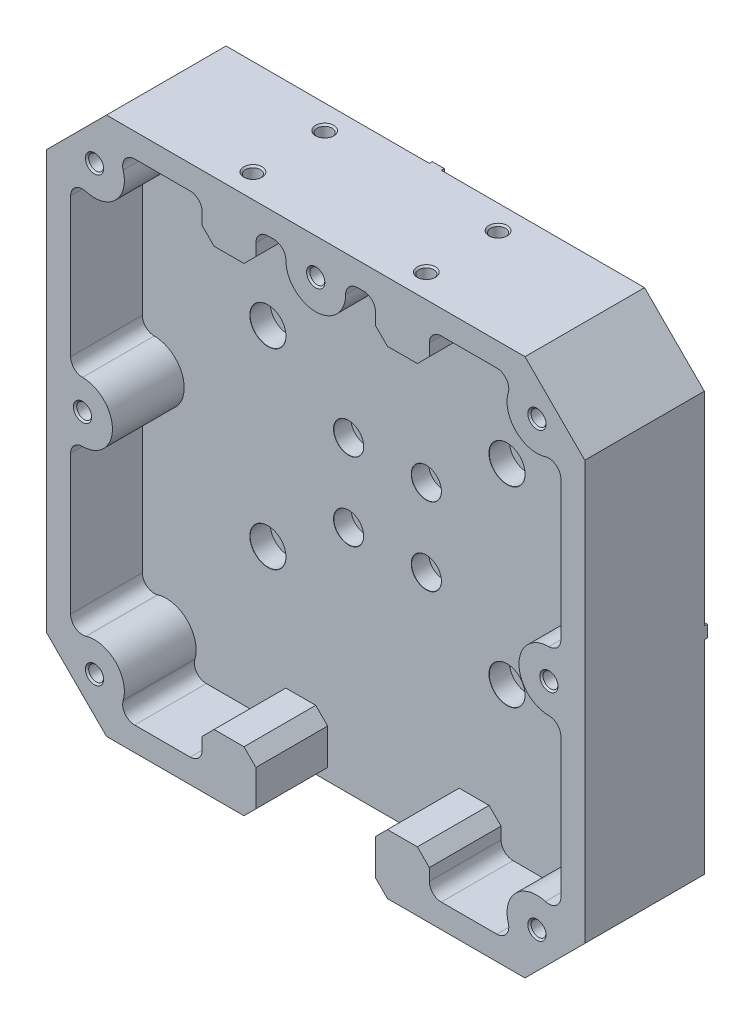
from build123d import *

# Parameters (mm, degrees)
SKETCH1_W                                    = 90
SKETCH1_H                                    = 90
BOSS_EXTRUDE1_DEPTH                          = 8
SKETCH7_W                                    = 44
SKETCH7_H                                    = 2
SKETCH7_W_2                                  = 2
SKETCH7_H_2                                  = 44
BOSS_EXTRUDE2_DEPTH                          = 0.5
FILLET1_R                                    = 0.5
CBORE_FOR_M2_5_HEXAGON_SOCKET_HEAD_C_2_COUNT = 2
CBORE_FOR_M2_5_HEXAGON_SOCKET_HEAD_C_2_PITCH = 13
CBORE_FOR_M2_5_HEXAGON_SOCKET_HEAD_C_3_COUNT = 2
CBORE_FOR_M2_5_HEXAGON_SOCKET_HEAD_C_3_PITCH = 13
CBORE_FOR_M2_5_HEXAGON_SOCKET_HEAD_C_4_COUNT = 2
CBORE_FOR_M2_5_HEXAGON_SOCKET_HEAD_C_4_PITCH = 18.384776311
CBORE_FOR_M3_HEXAGON_SOCKET_HEAD_CAP_2_COUNT = 2
CBORE_FOR_M3_HEXAGON_SOCKET_HEAD_CAP_2_PITCH = 32
CBORE_FOR_M3_HEXAGON_SOCKET_HEAD_CAP_3_COUNT = 2
CBORE_FOR_M3_HEXAGON_SOCKET_HEAD_CAP_3_PITCH = 51.224993899
CBORE_FOR_M3_HEXAGON_SOCKET_HEAD_CAP_4_COUNT = 2
CBORE_FOR_M3_HEXAGON_SOCKET_HEAD_CAP_4_PITCH = 40
CHAMFER2_SIZE                                = 10
BOSS_EXTRUDE8_DEPTH                          = 12
BOSS_EXTRUDE9_DEPTH                          = 12
SKETCH37_W                                   = 20
SKETCH37_H                                   = 8
CUT_EXTRUDE4_DEPTH                           = 12
SKETCH41_W                                   = 9
SKETCH41_H                                   = 6
BOSS_EXTRUDE10_DEPTH                         = 12
CHAMFER3_SIZE                                = 2
FILLET6_R                                    = 2
FILLET7_R                                    = 2
FILLET8_R                                    = 2
FILLET9_R                                    = 2
FILLET10_R                                   = 2
FILLET11_R                                   = 2
FILLET12_R                                   = 2
FILLET13_R                                   = 2
M3_TAPPED_HOLE2_D                            = 2.5
M3_TAPPED_HOLE2_CSINK_D                      = 3.05
M3_TAPPED_HOLE2_CSINK_ANGLE                  = 90
FILLET14_R                                   = 2
M3_TAPPED_HOLE1_AT_2_COUNT                   = 2
M3_TAPPED_HOLE1_AT_2_PITCH                   = 12
M3_TAPPED_HOLE1_AT_3_COUNT                   = 2
M3_TAPPED_HOLE1_AT_3_PITCH                   = 29
M3_TAPPED_HOLE1_AT_4_COUNT                   = 2
M3_TAPPED_HOLE1_AT_4_PITCH                   = 31.384709653


# Some blends are built 0.0001 mm under size
with BuildPart() as part:
    # Sketch1 → Boss-Extrude1 (new body)
    with BuildSketch(Plane.XY):
        Rectangle(SKETCH1_W, SKETCH1_H)
    extrude(amount=BOSS_EXTRUDE1_DEPTH)

    # Sketch7 → Boss-Extrude2 (add)
    with BuildSketch(Plane(origin=(0, 0, 0), x_dir=(-1, 0, 0), z_dir=(0, 0, -1))):
        with Locations((-23, 0)):
            Rectangle(SKETCH7_W, SKETCH7_H)
        Rectangle(SKETCH7_W_2, SKETCH7_H)
        with Locations((0, 23)):
            Rectangle(SKETCH7_W_2, SKETCH7_H_2)
        with Locations((23, 0)):
            Rectangle(SKETCH7_W, SKETCH7_H)
        with Locations((0, -23)):
            Rectangle(SKETCH7_W_2, SKETCH7_H_2)
    extrude(amount=BOSS_EXTRUDE2_DEPTH)

    # Fillet1
    fillet1_edges = [part.edges().sort_by_distance(p)[0] for p in [
        (1, -1, -0.25),
        (-1, -1, -0.25),
        (-1, 1, -0.25),
        (1, 1, -0.25),
    ]]
    fillet(fillet1_edges, radius=FILLET1_R)

    # Sketch9 → CBORE for M2.5 Hexagon socket head cap screws1 (revolve, cut)
    with BuildSketch(Plane(origin=(-6.5, 6.5, 8), x_dir=(0, -1, 0), z_dir=(1, 0, 0))):
        Polygon((0, 0), (0, 8.5), (1.35, 8.5), (1.35, 2.9), (2.5, 2.9), (2.5, 0.025), (2.525, 0), align=None)
    cbore_for_m2_5_hexagon_socket_head_cap_s = revolve(axis=Axis((-6.5, 6.5, 14.35), (0, 0, -1)), mode=Mode.SUBTRACT)

    # CBORE for M2.5 Hexagon socket head c 2: CBORE for M2.5 Hexagon socket head cap screws1 ×2
    with Locations(*[(i * CBORE_FOR_M2_5_HEXAGON_SOCKET_HEAD_C_2_PITCH, 0, 0) for i in range(1, CBORE_FOR_M2_5_HEXAGON_SOCKET_HEAD_C_2_COUNT)]):
        add(cbore_for_m2_5_hexagon_socket_head_cap_s, mode=Mode.SUBTRACT)

    # CBORE for M2.5 Hexagon socket head c 3: CBORE for M2.5 Hexagon socket head cap screws1 ×2
    with Locations(*[(0, -i * CBORE_FOR_M2_5_HEXAGON_SOCKET_HEAD_C_3_PITCH, 0) for i in range(1, CBORE_FOR_M2_5_HEXAGON_SOCKET_HEAD_C_3_COUNT)]):
        add(cbore_for_m2_5_hexagon_socket_head_cap_s, mode=Mode.SUBTRACT)

    # CBORE for M2.5 Hexagon socket head c 4: CBORE for M2.5 Hexagon socket head cap screws1 ×2
    with Locations(*[Vector(0.707106781186547, -0.7071067811865481, 0) * (i * CBORE_FOR_M2_5_HEXAGON_SOCKET_HEAD_C_4_PITCH) for i in range(1, CBORE_FOR_M2_5_HEXAGON_SOCKET_HEAD_C_4_COUNT)]):
        add(cbore_for_m2_5_hexagon_socket_head_cap_s, mode=Mode.SUBTRACT)

    # Sketch6 → CBORE for M3 Hexagon socket head cap screws1 (revolve, cut)
    with BuildSketch(Plane(origin=(20, -16, 8), x_dir=(0, -1, 0), z_dir=(1, 0, 0))):
        Polygon((0, 0), (0, 8.5), (1.6, 8.5), (1.6, 3.4), (3, 3.4), (3, 0.025), (3.025, 0), align=None)
    cbore_for_m3_hexagon_socket_head_cap_scr = revolve(axis=Axis((20, -16, 14.35), (0, 0, -1)), mode=Mode.SUBTRACT)

    # CBORE for M3 Hexagon socket head cap 2: CBORE for M3 Hexagon socket head cap screws1 ×2
    with Locations(*[(0, i * CBORE_FOR_M3_HEXAGON_SOCKET_HEAD_CAP_2_PITCH, 0) for i in range(1, CBORE_FOR_M3_HEXAGON_SOCKET_HEAD_CAP_2_COUNT)]):
        add(cbore_for_m3_hexagon_socket_head_cap_scr, mode=Mode.SUBTRACT)

    # CBORE for M3 Hexagon socket head cap 3: CBORE for M3 Hexagon socket head cap screws1 ×2
    with Locations(*[Vector(-0.7808688094430304, 0.6246950475544244, 0) * (i * CBORE_FOR_M3_HEXAGON_SOCKET_HEAD_CAP_3_PITCH) for i in range(1, CBORE_FOR_M3_HEXAGON_SOCKET_HEAD_CAP_3_COUNT)]):
        add(cbore_for_m3_hexagon_socket_head_cap_scr, mode=Mode.SUBTRACT)

    # CBORE for M3 Hexagon socket head cap 4: CBORE for M3 Hexagon socket head cap screws1 ×2
    with Locations(*[(-i * CBORE_FOR_M3_HEXAGON_SOCKET_HEAD_CAP_4_PITCH, 0, 0) for i in range(1, CBORE_FOR_M3_HEXAGON_SOCKET_HEAD_CAP_4_COUNT)]):
        add(cbore_for_m3_hexagon_socket_head_cap_scr, mode=Mode.SUBTRACT)

    # Chamfer2
    chamfer2_edges = [part.edges().sort_by_distance(p)[0] for p in [
        (45, -45, 4),
        (-45, -45, 4),
        (-45, 45, 4),
        (45, 45, 4),
    ]]
    chamfer(chamfer2_edges, length=CHAMFER2_SIZE)

    # Sketch34 → Boss-Extrude8 (add)
    with BuildSketch(Plane.XY.offset(8)):
        Polygon((35, 45), (-35, 45), (-45, 35), (-45, -35), (-35, -45), (35, -45), (45, -35), (45, 35), align=None)
        Polygon((33.343145751, 41), (-33.343145751, 41), (-41, 33.343145751), (-41, -33.343145751), (-33.343145751, -41), (33.343145751, -41), (41, -33.343145751), (41, 33.343145751), align=None, mode=Mode.SUBTRACT)
    extrude(amount=BOSS_EXTRUDE8_DEPTH)

    # Sketch36 → Boss-Extrude9 (add)
    with BuildSketch(Plane.XY.offset(8)):
        with BuildLine():
            ThreePointArc((-32, 37), (-32.42840413, 39.024971901), (-33.640204479, 40.702941271))
            Line((-33.640204479, 40.702941271), (-40.702941271, 33.640204479))
            ThreePointArc((-40.702941271, 33.640204479), (-35.199264922, 32.335522197), (-32, 37))
        make_face()
        with BuildLine():
            Line((-4.582575695, 41), (4.582575695, 41))
            ThreePointArc((4.582575695, 41), (0, 44), (-4.582575695, 41))
        make_face()
        with BuildLine():
            ThreePointArc((5, 39), (4.894531565, 40.021548218), (4.582575695, 41))
            Line((4.582575695, 41), (-4.582575695, 41))
            ThreePointArc((-4.582575695, 41), (-1.021548218, 34.105468435), (5, 39))
        make_face()
        with BuildLine():
            Line((40.702941271, 33.640204479), (33.640204479, 40.702941271))
            ThreePointArc((33.640204479, 40.702941271), (33.464466094, 33.464466094), (40.702941271, 33.640204479))
        make_face()
        with BuildLine():
            Line((41, -4.582575695), (41, 4.582575695))
            ThreePointArc((41, 4.582575695), (34, 0), (41, -4.582575695))
        make_face()
        with BuildLine():
            ThreePointArc((44, 0), (43.183300133, 2.738612788), (41, 4.582575695))
            Line((41, 4.582575695), (41, -4.582575695))
            ThreePointArc((41, -4.582575695), (43.183300133, -2.738612788), (44, 0))
        make_face()
        with BuildLine():
            Line((-41, -4.582575695), (-41, 4.582575695))
            ThreePointArc((-41, 4.582575695), (-44, 0), (-41, -4.582575695))
        make_face()
        with BuildLine():
            ThreePointArc((-34, 0), (-36.261387212, 4.183300133), (-41, 4.582575695))
            Line((-41, 4.582575695), (-41, -4.582575695))
            ThreePointArc((-41, -4.582575695), (-36.261387212, -4.183300133), (-34, 0))
        make_face()
        with BuildLine():
            Line((-40.702941271, -33.640204479), (-33.640204479, -40.702941271))
            ThreePointArc((-33.640204479, -40.702941271), (-32.42840413, -39.024971901), (-32, -37))
            ThreePointArc((-32, -37), (-35.199264922, -32.335522197), (-40.702941271, -33.640204479))
        make_face()
        with BuildLine():
            ThreePointArc((40.702941271, -33.640204479), (33.464466094, -33.464466094), (33.640204479, -40.702941271))
            Line((33.640204479, -40.702941271), (40.702941271, -33.640204479))
        make_face()
    extrude(amount=BOSS_EXTRUDE9_DEPTH)

    # Sketch37 → Cut-Extrude4 (cut)
    with BuildSketch(Plane.XY.offset(20)):
        with Locations((0, -41)):
            Rectangle(SKETCH37_W, SKETCH37_H)
    extrude(amount=-CUT_EXTRUDE4_DEPTH, mode=Mode.SUBTRACT)

    # Sketch41 → Boss-Extrude10 (add)
    with BuildSketch(Plane.XY.offset(8)):
        with Locations((-14.5, 38)):
            Rectangle(SKETCH41_W, SKETCH41_H)
        with Locations((-14.5, -38)):
            Rectangle(SKETCH41_W, SKETCH41_H)
        with Locations((14.5, -38)):
            Rectangle(SKETCH41_W, SKETCH41_H)
        with Locations((14.5, 38)):
            Rectangle(SKETCH41_W, SKETCH41_H)
    extrude(amount=BOSS_EXTRUDE10_DEPTH)

    # Chamfer3
    chamfer3_edges = [part.edges().sort_by_distance(p)[0] for p in [
        (-10, -45, 14),
        (10, -45, 14),
        (-19, 35, 14),
        (-10, 35, 14),
        (-10, -35, 14),
        (-19, -35, 14),
        (19, -35, 14),
        (10, -35, 14),
        (10, 35, 14),
        (19, 35, 14),
    ]]
    chamfer(chamfer3_edges, length=CHAMFER3_SIZE)

    # Fillet6
    # the kernel refuses this fillet: 2 mm, written as the material it adds along each edge
    with BuildSketch(Plane(origin=(-33.343145751, -41, 0.371625792), x_dir=(0.40371948691703236, 0.9148828208483577, 0), z_dir=(0, 0, 1))) as fillet6_piece_1:
        with BuildLine():
            CenterArc((3.06165497, -1.984188432), FILLET6_R, 97.209358864, 106.601549599)
            Line((1.231889328, -2.791627405), (1.048912764, -2.872371303))
            Line((1.048912764, -2.872371303), (-0.182976564, -0.080743897))
            Line((-0.182976564, -0.080743897), (-0.186478527, 0.072289412))
            ThreePointArc((-0.186478527, 0.072289412), (0.233099227, 0.574453075), (2.785565339, 0.198418843))
            Line((2.785565339, 0.198418843), (2.810664396, 0))
        make_face()
    extrude(amount=19.628374208)
    with BuildSketch(Plane(origin=(-33.640204479, -40.702941271, -0.403898939), x_dir=(0.5327514700348938, 0.846271747830246, 0), z_dir=(0, 0, 1))) as fillet6_piece_2_section:
        with BuildLine():
            CenterArc((3.22502059, -1.926418973), FILLET6_R, 105.590000171, 106.601549599)
            Line((1.532477094, -2.991921913), (1.363222744, -3.098472207))
            ThreePointArc((1.363222744, -3.098472207), (-0.262388285, -0.516201178), (-0.195023334, 0.044338463))
            Line((-0.195023334, 0.044338463), (0.053750343, 0.192641897))
            ThreePointArc((0.053750343, 0.192641897), (1.343758579, 0.016047433), (2.633766815, 0.192641897))
            Line((2.633766815, 0.192641897), (2.687517158, 0))
        make_face()
    fillet6_piece_2 = extrude(amount=20.403898939, mode=Mode.PRIVATE)
    fillet6_piece_2 = split(fillet6_piece_2, bisect_by=Plane(origin=(-33.640204479, -40.702941271, 0), z_dir=(0, 0, 1)), keep=Keep.TOP, mode=Mode.PRIVATE)
    add(fillet6_piece_2)

    # Fillet7
    # the kernel refuses this fillet: 2 mm, written as the material it adds along each edge
    with BuildSketch(Plane(origin=(-41, -33.343145751, 0.371625792), x_dir=(0, 1, 0), z_dir=(0, 0, 1))) as fillet7_piece_1:
        with BuildLine():
            CenterArc((3.051349683, -2), FILLET7_R, 90, 106.601549599)
            Line((1.134719988, -2.571428571), (0.943057019, -2.628571429))
            ThreePointArc((0.943057019, -2.628571429), (-0.43145055, -0.44517638), (-0.141421356, 0.141421356))
            Line((-0.141421356, 0.141421356), (0, 0.2))
            Line((0, 0.2), (3.051349683, 0.2))
            Line((3.051349683, 0.2), (3.051349683, 0))
        make_face()
    extrude(amount=19.628374208)
    with BuildSketch(Plane(origin=(-40.702941271, -33.640204479, -0.403898939), x_dir=(0.8462717478302307, 0.5327514700349183, 0), z_dir=(0, 0, 1))) as fillet7_piece_2_section:
        with BuildLine():
            CenterArc((3.22502059, 1.926418973), FILLET7_R, 147.80845023, 106.601549599)
            Line((1.532477094, 2.991921913), (1.363222744, 3.098472207))
            ThreePointArc((1.363222744, 3.098472207), (-0.262388285, 0.516201178), (-0.195023334, -0.044338463))
            Line((-0.195023334, -0.044338463), (0.053750343, -0.192641897))
            ThreePointArc((0.053750343, -0.192641897), (1.343758579, -0.016047433), (2.633766815, -0.192641897))
            Line((2.633766815, -0.192641897), (2.687517158, 0))
        make_face()
    fillet7_piece_2 = extrude(amount=20.403898939, mode=Mode.PRIVATE)
    fillet7_piece_2 = split(fillet7_piece_2, bisect_by=Plane(origin=(-40.702941271, -33.640204479, 0), z_dir=(0, 0, 1)), keep=Keep.TOP, mode=Mode.PRIVATE)
    add(fillet7_piece_2)

    # Fillet8
    # the kernel refuses this fillet: 2 mm, written as the material it adds along each edge
    with BuildSketch(Plane(origin=(-41, 33.343145751, 0.371625792), x_dir=(0.9148828208483512, -0.4037194869170472, 0), z_dir=(0, 0, 1))) as fillet8_piece_1:
        with BuildLine():
            CenterArc((3.06165497, -1.984188432), FILLET8_R, 97.209358864, 106.601549599)
            Line((1.231889328, -2.791627405), (1.048912764, -2.872371303))
            Line((1.048912764, -2.872371303), (-0.182976564, -0.080743897))
            Line((-0.182976564, -0.080743897), (-0.186478527, 0.072289412))
            ThreePointArc((-0.186478527, 0.072289412), (0.233099227, 0.574453075), (2.785565339, 0.198418843))
            Line((2.785565339, 0.198418843), (2.810664396, 0))
        make_face()
    extrude(amount=19.628374208)
    with BuildSketch(Plane(origin=(-40.702941271, 33.640204479, -0.403898939), x_dir=(0.8462717478302436, -0.5327514700348979, 0), z_dir=(0, 0, 1))) as fillet8_piece_2_section:
        with BuildLine():
            CenterArc((3.22502059, -1.926418973), FILLET8_R, 105.590000171, 106.601549599)
            Line((1.532477094, -2.991921913), (1.363222744, -3.098472207))
            ThreePointArc((1.363222744, -3.098472207), (-0.262388285, -0.516201178), (-0.195023334, 0.044338463))
            Line((-0.195023334, 0.044338463), (0.053750343, 0.192641897))
            ThreePointArc((0.053750343, 0.192641897), (1.343758579, 0.016047433), (2.633766815, 0.192641897))
            Line((2.633766815, 0.192641897), (2.687517158, 0))
        make_face()
    fillet8_piece_2 = extrude(amount=20.403898939, mode=Mode.PRIVATE)
    fillet8_piece_2 = split(fillet8_piece_2, bisect_by=Plane(origin=(-40.702941271, 33.640204479, 0), z_dir=(0, 0, 1)), keep=Keep.TOP, mode=Mode.PRIVATE)
    add(fillet8_piece_2)

    # Fillet9
    # the kernel refuses this fillet: 2 mm, written as the material it adds along each edge
    with BuildSketch(Plane(origin=(-33.343145751, 41, 0.371625792), x_dir=(1, 0, 0), z_dir=(0, 0, 1))) as fillet9_piece_1:
        with BuildLine():
            CenterArc((3.051349683, -2), FILLET9_R, 90, 106.601549599)
            Line((1.134719988, -2.571428571), (0.943057019, -2.628571429))
            ThreePointArc((0.943057019, -2.628571429), (-0.43145055, -0.44517638), (-0.141421356, 0.141421356))
            Line((-0.141421356, 0.141421356), (0, 0.2))
            Line((0, 0.2), (3.051349683, 0.2))
            Line((3.051349683, 0.2), (3.051349683, 0))
        make_face()
    extrude(amount=19.628374208)
    with BuildSketch(Plane(origin=(-33.640204479, 40.702941271, -0.403898939), x_dir=(0.5327514700348938, -0.846271747830246, 0), z_dir=(0, 0, 1))) as fillet9_piece_2_section:
        with BuildLine():
            CenterArc((3.22502059, 1.926418973), FILLET9_R, 147.80845023, 106.601549599)
            Line((1.532477094, 2.991921913), (1.363222744, 3.098472207))
            ThreePointArc((1.363222744, 3.098472207), (-0.262388285, 0.516201178), (-0.195023334, -0.044338463))
            Line((-0.195023334, -0.044338463), (0.053750343, -0.192641897))
            ThreePointArc((0.053750343, -0.192641897), (1.343758579, -0.016047433), (2.633766815, -0.192641897))
            Line((2.633766815, -0.192641897), (2.687517158, 0))
        make_face()
    fillet9_piece_2 = extrude(amount=20.403898939, mode=Mode.PRIVATE)
    fillet9_piece_2 = split(fillet9_piece_2, bisect_by=Plane(origin=(-33.640204479, 40.702941271, 0), z_dir=(0, 0, 1)), keep=Keep.TOP, mode=Mode.PRIVATE)
    add(fillet9_piece_2)

    # Fillet10
    # the kernel refuses this fillet: 2 mm, written as the material it adds along each edge
    with BuildSketch(Plane(origin=(33.343145751, 41, 0.371625792), x_dir=(-0.40371948691702175, -0.9148828208483623, 0), z_dir=(0, 0, 1))) as fillet10_piece_1:
        with BuildLine():
            CenterArc((3.06165497, -1.984188432), FILLET10_R, 97.209358864, 106.601549599)
            Line((1.231889328, -2.791627405), (1.048912764, -2.872371303))
            Line((1.048912764, -2.872371303), (-0.182976564, -0.080743897))
            Line((-0.182976564, -0.080743897), (-0.186478527, 0.072289412))
            ThreePointArc((-0.186478527, 0.072289412), (0.233099227, 0.574453075), (2.785565339, 0.198418843))
            Line((2.785565339, 0.198418843), (2.810664396, 0))
        make_face()
    extrude(amount=19.628374208)
    with BuildSketch(Plane(origin=(33.640204479, 40.702941271, -0.403898939), x_dir=(-0.5327514700348993, -0.8462717478302427, 0), z_dir=(0, 0, 1))) as fillet10_piece_2_section:
        with BuildLine():
            CenterArc((3.22502059, -1.926418973), FILLET10_R, 105.590000171, 106.601549599)
            Line((1.532477094, -2.991921913), (1.363222744, -3.098472207))
            ThreePointArc((1.363222744, -3.098472207), (-0.262388285, -0.516201178), (-0.195023334, 0.044338463))
            Line((-0.195023334, 0.044338463), (0.053750343, 0.192641897))
            ThreePointArc((0.053750343, 0.192641897), (1.343758579, 0.016047433), (2.633766815, 0.192641897))
            Line((2.633766815, 0.192641897), (2.687517158, 0))
        make_face()
    fillet10_piece_2 = extrude(amount=20.403898939, mode=Mode.PRIVATE)
    fillet10_piece_2 = split(fillet10_piece_2, bisect_by=Plane(origin=(33.640204479, 40.702941271, 0), z_dir=(0, 0, 1)), keep=Keep.TOP, mode=Mode.PRIVATE)
    add(fillet10_piece_2)

    # Fillet11
    # the kernel refuses this fillet: 2 mm, written as the material it adds along each edge
    with BuildSketch(Plane(origin=(41, 33.343145751, 0.371625792), x_dir=(0, -1, 0), z_dir=(0, 0, 1))) as fillet11_piece_1:
        with BuildLine():
            CenterArc((3.051349683, -2), FILLET11_R, 90, 106.601549599)
            Line((1.134719988, -2.571428571), (0.943057019, -2.628571429))
            ThreePointArc((0.943057019, -2.628571429), (-0.43145055, -0.44517638), (-0.141421356, 0.141421356))
            Line((-0.141421356, 0.141421356), (0, 0.2))
            Line((0, 0.2), (3.051349683, 0.2))
            Line((3.051349683, 0.2), (3.051349683, 0))
        make_face()
    extrude(amount=19.628374208)
    with BuildSketch(Plane(origin=(40.702941271, 33.640204479, -0.403898939), x_dir=(-0.8462717478302488, -0.5327514700348893, 0), z_dir=(0, 0, 1))) as fillet11_piece_2_section:
        with BuildLine():
            CenterArc((3.22502059, 1.926418973), FILLET11_R, 147.80845023, 106.601549599)
            Line((1.532477094, 2.991921913), (1.363222744, 3.098472207))
            ThreePointArc((1.363222744, 3.098472207), (-0.262388285, 0.516201178), (-0.195023334, -0.044338463))
            Line((-0.195023334, -0.044338463), (0.053750343, -0.192641897))
            ThreePointArc((0.053750343, -0.192641897), (1.343758579, -0.016047433), (2.633766815, -0.192641897))
            Line((2.633766815, -0.192641897), (2.687517158, 0))
        make_face()
    fillet11_piece_2 = extrude(amount=20.403898939, mode=Mode.PRIVATE)
    fillet11_piece_2 = split(fillet11_piece_2, bisect_by=Plane(origin=(40.702941271, 33.640204479, 0), z_dir=(0, 0, 1)), keep=Keep.TOP, mode=Mode.PRIVATE)
    add(fillet11_piece_2)

    # Fillet12
    # the kernel refuses this fillet: 2 mm, written as the material it adds along each edge
    with BuildSketch(Plane(origin=(41, -33.343145751, 0.371625792), x_dir=(-0.9148828208483571, 0.4037194869170333, 0), z_dir=(0, 0, 1))) as fillet12_piece_1:
        with BuildLine():
            CenterArc((3.06165497, -1.984188432), FILLET12_R, 97.209358864, 106.601549599)
            Line((1.231889328, -2.791627405), (1.048912764, -2.872371303))
            Line((1.048912764, -2.872371303), (-0.182976564, -0.080743897))
            Line((-0.182976564, -0.080743897), (-0.186478527, 0.072289412))
            ThreePointArc((-0.186478527, 0.072289412), (0.233099227, 0.574453075), (2.785565339, 0.198418843))
            Line((2.785565339, 0.198418843), (2.810664396, 0))
        make_face()
    extrude(amount=19.628374208)
    with BuildSketch(Plane(origin=(40.702941271, -33.640204479, -0.403898939), x_dir=(-0.8462717478302377, 0.5327514700349071, 0), z_dir=(0, 0, 1))) as fillet12_piece_2_section:
        with BuildLine():
            CenterArc((3.22502059, -1.926418973), FILLET12_R, 105.590000171, 106.601549599)
            Line((1.532477094, -2.991921913), (1.363222744, -3.098472207))
            ThreePointArc((1.363222744, -3.098472207), (-0.262388285, -0.516201178), (-0.195023334, 0.044338463))
            Line((-0.195023334, 0.044338463), (0.053750343, 0.192641897))
            ThreePointArc((0.053750343, 0.192641897), (1.343758579, 0.016047433), (2.633766815, 0.192641897))
            Line((2.633766815, 0.192641897), (2.687517158, 0))
        make_face()
    fillet12_piece_2 = extrude(amount=20.403898939, mode=Mode.PRIVATE)
    fillet12_piece_2 = split(fillet12_piece_2, bisect_by=Plane(origin=(40.702941271, -33.640204479, 0), z_dir=(0, 0, 1)), keep=Keep.TOP, mode=Mode.PRIVATE)
    add(fillet12_piece_2)

    # Fillet13
    # the kernel refuses this fillet: 2 mm, written as the material it adds along each edge
    with BuildSketch(Plane(origin=(33.343145751, -41, 0.371625792), x_dir=(-1, 0, 0), z_dir=(0, 0, 1))) as fillet13_piece_1:
        with BuildLine():
            CenterArc((3.051349683, -2), FILLET13_R, 90, 106.601549599)
            Line((1.134719988, -2.571428571), (0.943057019, -2.628571429))
            ThreePointArc((0.943057019, -2.628571429), (-0.43145055, -0.44517638), (-0.141421356, 0.141421356))
            Line((-0.141421356, 0.141421356), (0, 0.2))
            Line((0, 0.2), (3.051349683, 0.2))
            Line((3.051349683, 0.2), (3.051349683, 0))
        make_face()
    extrude(amount=19.628374208)
    with BuildSketch(Plane(origin=(33.640204479, -40.702941271, -0.403898939), x_dir=(-0.5327514700348989, 0.846271747830243, 0), z_dir=(0, 0, 1))) as fillet13_piece_2_section:
        with BuildLine():
            CenterArc((3.22502059, 1.926418973), FILLET13_R, 147.80845023, 106.601549599)
            Line((1.532477094, 2.991921913), (1.363222744, 3.098472207))
            ThreePointArc((1.363222744, 3.098472207), (-0.262388285, 0.516201178), (-0.195023334, -0.044338463))
            Line((-0.195023334, -0.044338463), (0.053750343, -0.192641897))
            ThreePointArc((0.053750343, -0.192641897), (1.343758579, -0.016047433), (2.633766815, -0.192641897))
            Line((2.633766815, -0.192641897), (2.687517158, 0))
        make_face()
    fillet13_piece_2 = extrude(amount=20.403898939, mode=Mode.PRIVATE)
    fillet13_piece_2 = split(fillet13_piece_2, bisect_by=Plane(origin=(33.640204479, -40.702941271, 0), z_dir=(0, 0, 1)), keep=Keep.TOP, mode=Mode.PRIVATE)
    add(fillet13_piece_2)

    # M3 Tapped Hole2 (through all)
    with Locations(Plane.XY.offset(20)):
        with Locations((-37, 37), (0, 39), (37, 37), (-39, 0), (39, 0), (-37, -37), (37, -37)):
            CounterSinkHole(M3_TAPPED_HOLE2_D / 2, M3_TAPPED_HOLE2_CSINK_D / 2, counter_sink_angle=M3_TAPPED_HOLE2_CSINK_ANGLE)

    # Fillet14
    fillet14_edges = [part.edges().sort_by_distance(p)[0] for p in [
        (4.582575695, 41, 14),
        (-4.582575695, 41, 14),
        (41, -4.582575695, 14),
        (41, 4.582575695, 14),
        (-41, 4.582575695, 14),
        (-41, -4.582575695, 14),
        (-19, 41, 14),
        (-10, 41, 14),
        (-19, -41, 14),
        (19, -41, 14),
        (19, 41, 14),
        (10, 41, 14),
    ]]
    fillet(fillet14_edges, radius=FILLET14_R - 0.0001)  # a hair under: the kernel refuses the full size

    # Sketch44 → M3 Tapped Hole1 (revolve, cut)
    with BuildSketch(Plane(origin=(14.5, -45, 4), x_dir=(0, 0, -1), z_dir=(1, 0, 0))):
        Polygon((0, 0), (0, 8.751075774), (1.25, 8), (1.25, 0.275), (1.525, 0), align=None)
    m3_tapped_hole1 = revolve(axis=Axis((14.5, -51.35, 4), (0, 1, 0)), mode=Mode.SUBTRACT)

    # M3 Tapped Hole1 at 2: M3 Tapped Hole1 ×2
    with Locations(*[(0, 0, i * M3_TAPPED_HOLE1_AT_2_PITCH) for i in range(1, M3_TAPPED_HOLE1_AT_2_COUNT)]):
        add(m3_tapped_hole1, mode=Mode.SUBTRACT)

    # M3 Tapped Hole1 at 3: M3 Tapped Hole1 ×2
    with Locations(*[(-i * M3_TAPPED_HOLE1_AT_3_PITCH, 0, 0) for i in range(1, M3_TAPPED_HOLE1_AT_3_COUNT)]):
        add(m3_tapped_hole1, mode=Mode.SUBTRACT)

    # M3 Tapped Hole1 at 4: M3 Tapped Hole1 ×2
    with Locations(*[Vector(-0.9240168324218908, 0, 0.3823517927262998) * (i * M3_TAPPED_HOLE1_AT_4_PITCH) for i in range(1, M3_TAPPED_HOLE1_AT_4_COUNT)]):
        add(m3_tapped_hole1, mode=Mode.SUBTRACT)

    # Mirror2: M3 Tapped Hole1 across plane
    add(m3_tapped_hole1.mirror(Plane.ZX), mode=Mode.SUBTRACT)

    # Mirror2 copy 1 sketch → Mirror2 copy 1 (revolve, cut)
    with BuildSketch(Plane(origin=(14.5, 45, 16), x_dir=(0, 0, -1), z_dir=(1, 0, 0))):
        Polygon((0, 0), (0, -8.751075774), (1.25, -8), (1.25, -0.275), (1.525, 0), align=None)
    revolve(axis=Axis((14.5, 51.35, 16), (0, 1, 0)), mode=Mode.SUBTRACT)

    # Mirror2 copy 2 sketch → Mirror2 copy 2 (revolve, cut)
    with BuildSketch(Plane(origin=(-14.5, 45, 4), x_dir=(0, 0, -1), z_dir=(1, 0, 0))):
        Polygon((0, 0), (0, -8.751075774), (1.25, -8), (1.25, -0.275), (1.525, 0), align=None)
    revolve(axis=Axis((-14.5, 51.35, 4), (0, 1, 0)), mode=Mode.SUBTRACT)

    # Mirror2 copy 3 sketch → Mirror2 copy 3 (revolve, cut)
    with BuildSketch(Plane(origin=(-14.5, 45, 16), x_dir=(0, 0, -1), z_dir=(1, 0, 0))):
        Polygon((0, 0), (0, -8.751075774), (1.25, -8), (1.25, -0.275), (1.525, 0), align=None)
    revolve(axis=Axis((-14.5, 51.35, 16), (0, 1, 0)), mode=Mode.SUBTRACT)


solid = part.part
